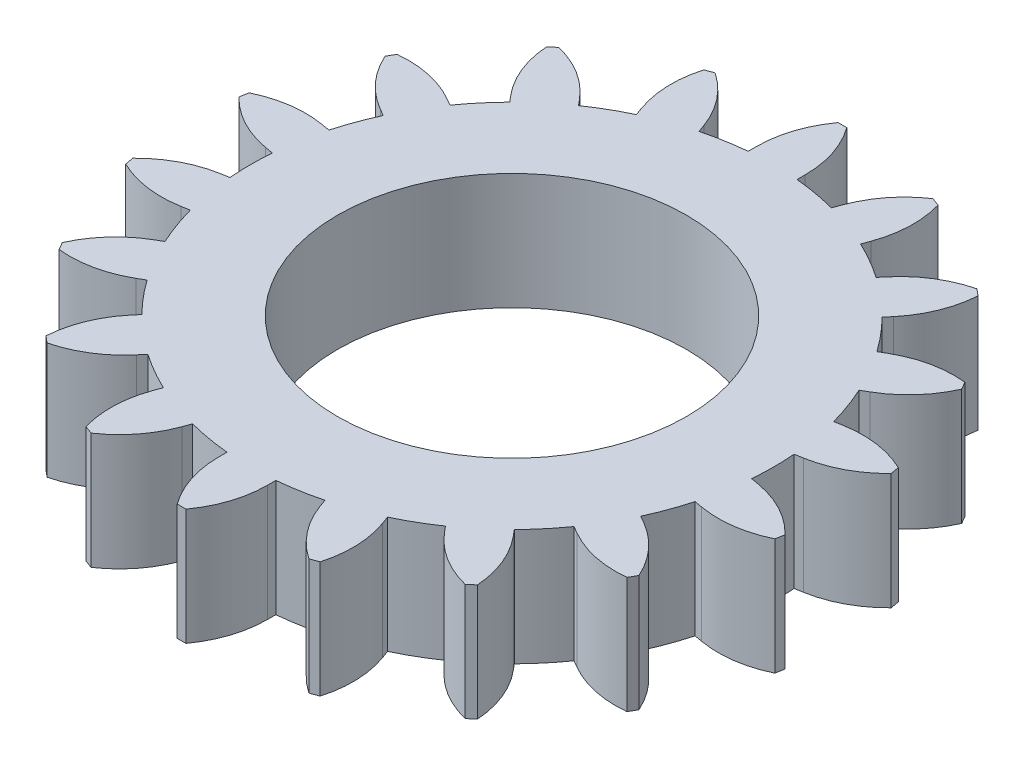
from build123d import *

# Parameters (mm, degrees)
SKETCH1_R           = 19.05
SKETCH1_R_2         = 12.7
BOSS_EXTRUDE1_DEPTH = 8.46582
BOSS_EXTRUDE2_DEPTH = 8.46582
CIRPATTERN1_COUNT   = 18
FILLET2_R           = 7.62


with BuildPart() as part:
    # Sketch1 → Boss-Extrude1 (new body)
    with BuildSketch(Plane(origin=(0, 0, 0), x_dir=(1, 0, 0), z_dir=(0, 1, 0))):
        with Locations(Location((0, 0, 0), (0, 0, 270))):
            Circle(SKETCH1_R)
        with Locations(Location((0, 0, 0), (0, 0, 270))):
            Circle(SKETCH1_R_2, mode=Mode.SUBTRACT)
    extrude(amount=BOSS_EXTRUDE1_DEPTH)

    # Sketch2 → Boss-Extrude2 (add)
    with BuildSketch(Plane(origin=(0, 0, 0), x_dir=(1, 0, 0), z_dir=(0, 1, 0))):
        with BuildLine():
            Line((-1.778, 18.966845178), (-1.778, 22.141845178))
            Line((-1.778, 22.141845178), (-0.3175, 24.046845178))
            Line((-0.3175, 24.046845178), (0.3175, 24.046845178))
            Line((0.3175, 24.046845178), (1.778, 22.141845178))
            Line((1.778, 22.141845178), (1.778, 18.966845178))
            ThreePointArc((1.778, 18.966845178), (0, 19.05), (-1.778, 18.966845178))
        make_face()
    boss_extrude2 = extrude(amount=BOSS_EXTRUDE2_DEPTH)

    # CirPattern1: Boss-Extrude2 ×18 about axis
    cirpattern1_axis = Axis((0, 0, 0), (0, 1, 0))
    for i in range(1, CIRPATTERN1_COUNT):
        add(boss_extrude2.rotate(cirpattern1_axis, i * 360 / CIRPATTERN1_COUNT))

    # Fillet2
    # the kernel refuses this fillet: 7.62 mm, written as the material it takes off along each edge
    with BuildSketch(Plane(origin=(1.778, -6.452712813, -22.141845178), x_dir=(0, 0, 1), z_dir=(0, 1, 0)), Plane(origin=(20.064400411, -6.452712813, -9.531129421), x_dir=(-0.8660254037844388, 0, 0.49999999999999956), z_dir=(0, 1, 0)), Plane(origin=(22.114207257, -6.452712813, -2.09390288), x_dir=(-0.9848077530122081, 0, 0.17364817766693005), z_dir=(0, 1, 0)), Plane(origin=(21.496714337, -6.452712813, 5.59587925), x_dir=(-0.9848077530122081, 0, -0.17364817766692997), z_dir=(0, 1, 0)), Plane(origin=(18.286400411, -6.452712813, 12.610715757), x_dir=(-0.8660254037844383, 0, -0.5000000000000006), z_dir=(0, 1, 0)), Plane(origin=(12.870476716, -6.452712813, 18.104513829), x_dir=(-0.6427876096865391, 0, -0.7660444431189781), z_dir=(0, 1, 0)), Plane(origin=(5.902183581, -6.452712813, 21.414640339), x_dir=(-0.34202014332566927, 0, -0.9396926207859082), z_dir=(0, 1, 0)), Plane(origin=(-1.778, -6.452712813, 22.141845178), x_dir=(0, 0, -1), z_dir=(0, 1, 0)), Plane(origin=(-9.243730541, -6.452712813, 20.198416709), x_dir=(0.34202014332566927, 0, -0.9396926207859082), z_dir=(0, 1, 0)), Plane(origin=(-15.594530756, -6.452712813, 15.818761089), x_dir=(0.6427876096865394, 0, -0.7660444431189781), z_dir=(0, 1, 0)), Plane(origin=(-20.064400411, -6.452712813, 9.531129421), x_dir=(0.8660254037844388, 0, -0.49999999999999956), z_dir=(0, 1, 0)), Plane(origin=(-22.114207257, -6.452712813, 2.09390288), x_dir=(0.984807753012208, 0, -0.17364817766693053), z_dir=(0, 1, 0)), Plane(origin=(-21.496714337, -6.452712813, -5.59587925), x_dir=(0.9848077530122081, 0, 0.17364817766693055), z_dir=(0, 1, 0)), Plane(origin=(15.594530756, -6.452712813, -15.818761089), x_dir=(-0.6427876096865398, 0, 0.7660444431189776), z_dir=(0, 1, 0)), Plane(origin=(-18.286400411, -6.452712813, -12.610715757), x_dir=(0.8660254037844386, 0, 0.5000000000000001), z_dir=(0, 1, 0)), Plane(origin=(-12.870476716, -6.452712813, -18.104513829), x_dir=(0.642787609686539, 0, 0.7660444431189781), z_dir=(0, 1, 0)), Plane(origin=(9.243730541, -6.452712813, -20.198416709), x_dir=(-0.3420201433256689, 0, 0.9396926207859084), z_dir=(0, 1, 0)), Plane(origin=(-5.902183581, -6.452712813, -21.414640339), x_dir=(0.3420201433256684, 0, 0.9396926207859084), z_dir=(0, 1, 0))) as fillet2_piece_1:
        with BuildLine():
            CenterArc((2.581085125, -7.62), FILLET2_R, 90, 36.06658826)
            Line((-1.905, -1.4605), (-1.994721703, -1.33731))
            ThreePointArc((-1.994721703, -1.33731), (-1.045224967, -0.609304391), (-0.092724967, 0.120945609))
            Line((-0.092724967, 0.120945609), (0, 0.1524))
            Line((0, 0.1524), (2.581085125, 0.1524))
            Line((2.581085125, 0.1524), (2.581085125, 0))
        make_face()
    extrude(amount=21.371245626, mode=Mode.SUBTRACT)
    with BuildSketch(Plane(origin=(-1.778, -6.452712813, -22.141845178), x_dir=(0.6084315436571524, 0, -0.7936063612919032), z_dir=(0, 1, 0)), Plane(origin=(22.114207257, -6.452712813, 2.09390288), x_dir=(0.6758966686489332, 0, 0.7369963997939708), z_dir=(0, 1, 0)), Plane(origin=(21.496714337, -6.452712813, -5.59587925), x_dir=(0.8872027262312159, 0, 0.4613798029475262), z_dir=(0, 1, 0)), Plane(origin=(20.064400411, -6.452712813, 9.531129421), x_dir=(0.38306749765514664, 0, 0.9237203539168248), z_dir=(0, 1, 0)), Plane(origin=(15.594530756, -6.452712813, 15.818761089), x_dir=(0.04403473296999355, 0, 0.9990300006968066), z_dir=(0, 1, 0)), Plane(origin=(9.243730541, -6.452712813, 20.198416709), x_dir=(-0.30030927039478544, 0, 0.9538418852802342), z_dir=(0, 1, 0)), Plane(origin=(1.778, -6.452712813, 22.141845178), x_dir=(-0.6084315436571494, 0, 0.7936063612919054), z_dir=(0, 1, 0)), Plane(origin=(-5.902183581, -6.452712813, 21.414640339), x_dir=(-0.8431679932612217, 0, 0.5376501977492841), z_dir=(0, 1, 0)), Plane(origin=(-12.870476716, -6.452712813, 18.104513829), x_dir=(-0.9762059390437181, 0, 0.21684548548626165), z_dir=(0, 1, 0)), Plane(origin=(-18.286400411, -6.452712813, 12.610715757), x_dir=(-0.9914990413122959, 0, -0.1301139926249219), z_dir=(0, 1, 0)), Plane(origin=(-21.496714337, -6.452712813, 5.59587925), x_dir=(-0.8872027262312162, 0, -0.4613798029475256), z_dir=(0, 1, 0)), Plane(origin=(-22.114207257, -6.452712813, -2.09390288), x_dir=(-0.675896668648932, 0, -0.7369963997939716), z_dir=(0, 1, 0)), Plane(origin=(-20.064400411, -6.452712813, -9.531129421), x_dir=(-0.3830674976551464, 0, -0.923720353916825), z_dir=(0, 1, 0)), Plane(origin=(-15.594530756, -6.452712813, -15.818761089), x_dir=(-0.04403473296998761, 0, -0.9990300006968068), z_dir=(0, 1, 0)), Plane(origin=(12.870476716, -6.452712813, -18.104513829), x_dir=(0.9762059390437176, 0, -0.21684548548626464), z_dir=(0, 1, 0)), Plane(origin=(18.286400411, -6.452712813, -12.610715757), x_dir=(0.9914990413122965, 0, 0.13011399262491774), z_dir=(0, 1, 0))) as fillet2_piece_2:
        with BuildLine():
            CenterArc((2.587882788, -7.61769408), FILLET2_R, 91.409591302, 36.06658826)
            Line((-2.048365574, -1.570413607), (-2.141090542, -1.449467998))
            Line((-2.141090542, -1.449467998), (-0.092724967, 0.120945609))
            Line((-0.092724967, 0.120945609), (0, 0.1524))
            ThreePointArc((0, 0.1524), (1.200217194, 0.1524), (2.39668542, 0.152353882))
            Line((2.39668542, 0.152353882), (2.400434388, 0))
        make_face()
    extrude(amount=21.371245626, mode=Mode.SUBTRACT)
    with BuildSketch(Plane(origin=(-9.243730541, -6.452712813, -20.198416709), x_dir=(0.34202014332566855, 0, 0.9396926207859084), z_dir=(0, 1, 0)), Plane(origin=(5.902183581, -6.452712813, -21.414640339), x_dir=(-0.34202014332566877, 0, 0.9396926207859084), z_dir=(0, 1, 0))) as fillet2_piece_3:
        with BuildLine():
            CenterArc((2.581085125, 7.62), FILLET2_R, 233.93341174, 36.06658826)
            Line((-1.905, 1.4605), (-1.994721703, 1.33731))
            ThreePointArc((-1.994721703, 1.33731), (-1.045224967, 0.609304391), (-0.092724967, -0.120945609))
            Line((-0.092724967, -0.120945609), (0, -0.1524))
            Line((0, -0.1524), (2.581085125, -0.1524))
            Line((2.581085125, -0.1524), (2.581085125, 0))
        make_face()
    extrude(amount=21.371245626, mode=Mode.SUBTRACT)


solid = part.part
